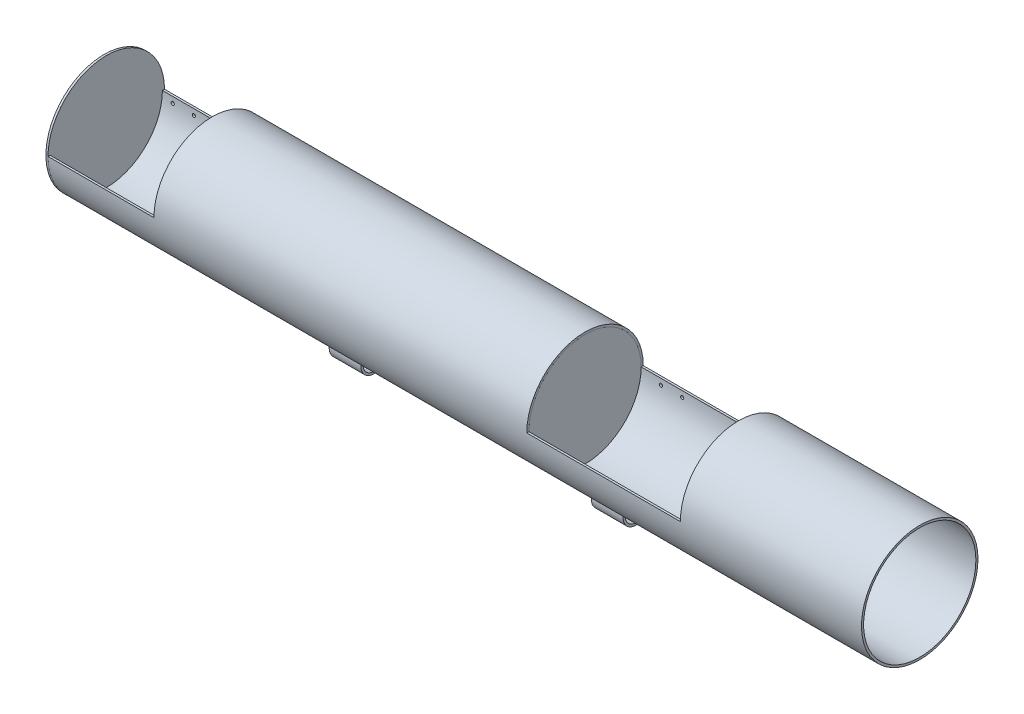
from build123d import *

# Parameters (mm, degrees)
SKETCH_2_R          = 55
SKETCH_2_R_2        = 53
EXTRUDE_1_DEPTH     = 768
SKETCH_3_R          = 53
EXTRUDE_2_DEPTH     = 2
SKETCH_7_R          = 55
EXTRUDE_5_DEPTH     = 2
SKETCH_8_R          = 53
EXTRUDE_6_DEPTH     = 2
SKETCH_14_W         = 145
SKETCH_14_H         = 55
CUT_REVOLVE_1_ANGLE = 180
SKETCH_16_W         = 100
SKETCH_16_H         = 55
CUT_REVOLVE_2_ANGLE = 180
SKETCH_22_R         = 1.5
CUT_EXTRUDE_4_DEPTH = 30
SKETCH_23_R         = 53
EXTRUDE_13_DEPTH    = 2
SKETCH_24_R         = 1.5
CUT_EXTRUDE_5_DEPTH = 30
SKETCH_25_R         = 12
SKETCH_25_R_2       = 10
EXTRUDE_14_DEPTH    = 30
SKETCH_26_R         = 12
SKETCH_26_R_2       = 10
EXTRUDE_15_DEPTH    = 30


with BuildPart() as part:
    # 草图2 → 凸台-拉伸1 (new body)
    with BuildSketch(Plane(origin=(0, 0, 0), x_dir=(0, 0, -1), z_dir=(1, 0, 0))):
        Circle(SKETCH_2_R)
        Circle(SKETCH_2_R_2, mode=Mode.SUBTRACT)
    extrude(amount=EXTRUDE_1_DEPTH)

    # 草图14 → 切除-旋转1 (revolve, cut)
    with BuildSketch(Plane(origin=(0, 0, 0), x_dir=(1, 0, 0), z_dir=(0, 1, 0))):
        with Locations((524.5, 27.5)):
            Rectangle(SKETCH_14_W, SKETCH_14_H)
    revolve(axis=Axis((452, 0, 0), (1, 0, 0)), revolution_arc=CUT_REVOLVE_1_ANGLE, mode=Mode.SUBTRACT)

    # 草图16 → 切除-旋转2 (revolve, cut)
    with BuildSketch(Plane(origin=(0, 0, 0), x_dir=(1, 0, 0), z_dir=(0, 1, 0))):
        with Locations((50, 27.5)):
            Rectangle(SKETCH_16_W, SKETCH_16_H)
    revolve(axis=Axis((0, 0, 0), (1, 0, 0)), revolution_arc=CUT_REVOLVE_2_ANGLE, mode=Mode.SUBTRACT)

    # 草图22 → 切除-拉伸4 (cut)
    with BuildSketch(Plane.XY.offset(-50)):
        with Locations((10, -5.4)):
            Circle(SKETCH_22_R)
        with Locations((30, -5.4)):
            Circle(SKETCH_22_R)
        with Locations((70, -5.4)):
            Circle(SKETCH_22_R)
        with Locations((90, -5.4)):
            Circle(SKETCH_22_R)
    extrude(amount=-CUT_EXTRUDE_4_DEPTH, mode=Mode.SUBTRACT)

    # 草图24 → 切除-拉伸5 (cut)
    with BuildSketch(Plane.XY.offset(-50)):
        with Locations((471, -5.4)):
            Circle(SKETCH_24_R)
        with Locations((491, -5.4)):
            Circle(SKETCH_24_R)
        with Locations((558, -5.4)):
            Circle(SKETCH_24_R)
        with Locations((578, -5.4)):
            Circle(SKETCH_24_R)
    extrude(amount=-CUT_EXTRUDE_5_DEPTH, mode=Mode.SUBTRACT)


with BuildPart() as body_2:
    # 草图3 → 凸台-拉伸2 (new body)
    with BuildSketch(Plane(origin=(100, 0, 0), x_dir=(0, 0, -1), z_dir=(1, 0, 0))):
        Circle(SKETCH_3_R)
    extrude(amount=EXTRUDE_2_DEPTH)


with BuildPart() as body_3:
    # 草图7 → 凸台-拉伸5 (new body)
    with BuildSketch(Plane(origin=(0, 0, 0), x_dir=(0, 0, -1), z_dir=(1, 0, 0))):
        Circle(SKETCH_7_R)
    extrude(amount=-EXTRUDE_5_DEPTH)


with BuildPart() as body_4:
    # 草图8 → 凸台-拉伸6 (new body)
    with BuildSketch(Plane(origin=(450, 0, 0), x_dir=(0, 0, -1), z_dir=(1, 0, 0))):
        Circle(SKETCH_8_R)
    extrude(amount=EXTRUDE_6_DEPTH)


with BuildPart() as body_5:
    # 草图23 → 凸台-拉伸13 (new body)
    with BuildSketch(Plane(origin=(597, 0, 0), x_dir=(0, 0, -1), z_dir=(1, 0, 0))):
        Circle(SKETCH_23_R)
    extrude(amount=EXTRUDE_13_DEPTH)


with BuildPart() as body_6:
    # 草图25 → 凸台-拉伸14 (new body)
    with BuildSketch(Plane(origin=(222.493365776, 0, 0), x_dir=(0, 0, -1), z_dir=(1, 0, 0))):
        with Locations((0, -67)):
            Circle(SKETCH_25_R)
        with Locations((0, -67)):
            Circle(SKETCH_25_R_2, mode=Mode.SUBTRACT)
    extrude(amount=EXTRUDE_14_DEPTH)


with BuildPart() as body_7:
    # 草图26 → 凸台-拉伸15 (new body)
    with BuildSketch(Plane(origin=(470, 0, 0), x_dir=(0, 0, -1), z_dir=(1, 0, 0))):
        with Locations((0, -67)):
            Circle(SKETCH_26_R)
        with Locations((0, -67)):
            Circle(SKETCH_26_R_2, mode=Mode.SUBTRACT)
    extrude(amount=EXTRUDE_15_DEPTH)


solid = Compound([part.part, body_2.part, body_3.part, body_4.part, body_5.part, body_6.part, body_7.part])
